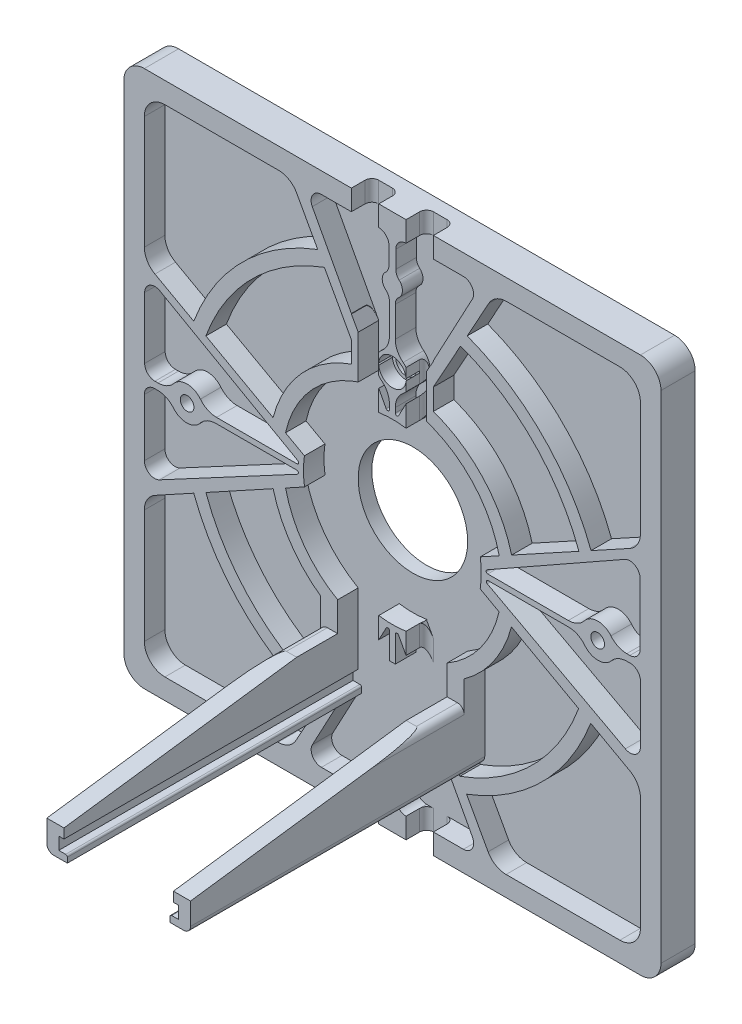
from build123d import *

# Parameters (mm, degrees)
EXTRUDE_2_DEPTH          = 5
SKETCH_6_R               = 13
CUT_EXTRUDE_2_DEPTH      = 3
CUT_EXTRUDE_4_DEPTH      = 3
SKETCH_12_R              = 18
SKETCH_12_R_2            = 16
EXTRUDE_7_DEPTH          = 3
SKETCH_18_R              = 31
SKETCH_18_R_2            = 29
EXTRUDE_10_DEPTH         = 3
CUT_EXTRUDE_7_DEPTH      = 3
CUT_EXTRUDE_7_DEPTH_BACK = 2
SKETCH_19_R              = 1
CHAMFER_6_SIZE           = 2
CUT_EXTRUDE_8_DEPTH      = 3
CUT_EXTRUDE_12_DEPTH     = 78.5
EXTRUDE_12_DEPTH         = 3
EXTRUDE_15_DEPTH         = 43
CUT_EXTRUDE_13_DEPTH     = 22
SKETCH_38_R              = 2
CUT_EXTRUDE_14_DEPTH     = 2
SKETCH_39_R              = 1.5
CUT_EXTRUDE_15_DEPTH     = 3
CUT_EXTRUDE_START        = -3
CUT_EXTRUDE_17_DEPTH     = 3
EXTRUDE_14_DEPTH         = 3
SKETCH_48_R              = 8
CUT_EXTRUDE_23_DEPTH     = 3


with BuildPart() as part:
    # Эскиз1 → Бобышка-Вытянуть2 (new body)
    with BuildSketch(Plane.XY):
        with BuildLine():
            Line((-36.25, -39.25), (36.25, -39.25))
            ThreePointArc((36.25, -39.25), (38.371320344, -38.371320344), (39.25, -36.25))
            Line((39.25, -36.25), (39.25, 36.25))
            ThreePointArc((39.25, 36.25), (38.371320344, 38.371320344), (36.25, 39.25))
            Line((36.25, 39.25), (-36.25, 39.25))
            ThreePointArc((-36.25, 39.25), (-38.371320344, 38.371320344), (-39.25, 36.25))
            Line((-39.25, 36.25), (-39.25, -36.25))
            ThreePointArc((-39.25, -36.25), (-38.371320344, -38.371320344), (-36.25, -39.25))
        make_face()
    extrude(amount=EXTRUDE_2_DEPTH)

    # Эскиз6 → Вырез-Вытянуть2 (cut)
    with BuildSketch(Plane.XY.offset(5)):
        Circle(SKETCH_6_R)
    extrude(amount=-CUT_EXTRUDE_2_DEPTH, mode=Mode.SUBTRACT)

    # Эскиз10 → Вырез-Вытянуть4 (cut)
    with BuildSketch(Plane.XY.offset(5)):
        with BuildLine():
            Line((-36.25, -33.25), (-36.25, -16.619482512))
            ThreePointArc((-36.25, -16.619482512), (-35.831646193, -15.091378152), (-34.69326471, -13.989465977))
            Line((-34.69326471, -13.989465977), (-12.845232579, -2))
            Line((-12.845232579, -2), (-2, -12.845232579))
            Line((-2, -12.845232579), (-14.087577933, -34.701877693))
            ThreePointArc((-14.087577933, -34.701877693), (-15.18897836, -35.834147159), (-16.712849569, -36.25))
            Line((-16.712849569, -36.25), (-33.25, -36.25))
            ThreePointArc((-33.25, -36.25), (-35.371320344, -35.371320344), (-36.25, -33.25))
        make_face()
        with BuildLine():
            Line((36.248456545, 33.245281978), (36.248456545, 16.61476449))
            ThreePointArc((36.248456545, 16.61476449), (35.830102738, 15.08666013), (34.691721255, 13.984747955))
            Line((34.691721255, 13.984747955), (12.843689124, 1.995281978))
            Line((12.843689124, 1.995281978), (1.998456545, 12.840514557))
            Line((1.998456545, 12.840514557), (14.086034478, 34.697159671))
            ThreePointArc((14.086034478, 34.697159671), (15.187434905, 35.829429137), (16.711306114, 36.245281978))
            Line((16.711306114, 36.245281978), (33.248456545, 36.245281978))
            ThreePointArc((33.248456545, 36.245281978), (35.369776888, 35.366602321), (36.248456545, 33.245281978))
        make_face()
        with BuildLine():
            Line((33.245281978, -36.317324444), (16.61476449, -36.317324444))
            ThreePointArc((16.61476449, -36.317324444), (15.08666013, -35.898970637), (13.984747955, -34.760589154))
            Line((13.984747955, -34.760589154), (1.995281978, -12.912557022))
            Line((1.995281978, -12.912557022), (12.840514557, -2.067324444))
            Line((12.840514557, -2.067324444), (34.697159671, -14.154902376))
            ThreePointArc((34.697159671, -14.154902376), (35.829429137, -15.256302804), (36.245281978, -16.780174013))
            Line((36.245281978, -16.780174013), (36.245281978, -33.317324444))
            ThreePointArc((36.245281978, -33.317324444), (35.366602321, -35.438644787), (33.245281978, -36.317324444))
        make_face()
        with BuildLine():
            Line((-33.25, 36.181132101), (-16.619482512, 36.181132101))
            ThreePointArc((-16.619482512, 36.181132101), (-15.091378152, 35.762778294), (-13.989465977, 34.624396812))
            Line((-13.989465977, 34.624396812), (-2, 12.77636468))
            Line((-2, 12.77636468), (-12.845232579, 1.931132101))
            Line((-12.845232579, 1.931132101), (-34.701877693, 14.018710034))
            ThreePointArc((-34.701877693, 14.018710034), (-35.834147159, 15.120110462), (-36.25, 16.64398167))
            Line((-36.25, 16.64398167), (-36.25, 33.181132101))
            ThreePointArc((-36.25, 33.181132101), (-35.371320344, 35.302452445), (-33.25, 36.181132101))
        make_face()
    extrude(amount=-CUT_EXTRUDE_4_DEPTH, mode=Mode.SUBTRACT)

    # Эскиз12 → Бобышка-Вытянуть7 (add)
    with BuildSketch(Plane.XY.offset(2)):
        Circle(SKETCH_12_R)
        Circle(SKETCH_12_R_2, mode=Mode.SUBTRACT)
    extrude(amount=EXTRUDE_7_DEPTH)

    # Эскиз18 → Бобышка-Вытянуть10 (add)
    with BuildSketch(Plane.XY.offset(2)):
        Circle(SKETCH_18_R)
        Circle(SKETCH_18_R_2, mode=Mode.SUBTRACT)
    extrude(amount=EXTRUDE_10_DEPTH)

    # Эскиз19 → Вырез-Вытянуть7 (cut, two sides: drawn at the far end of the back side and taken through both)
    with BuildSketch(Plane.XY.offset(2).offset(-CUT_EXTRUDE_7_DEPTH_BACK)):
        with Locations((-30, 0)):
            Circle(SKETCH_19_R)
        with Locations((30, 0)):
            Circle(SKETCH_19_R)
    extrude(amount=CUT_EXTRUDE_7_DEPTH + CUT_EXTRUDE_7_DEPTH_BACK, mode=Mode.SUBTRACT)

    # Фаска6
    chamfer_6_edges = [part.edges().sort_by_distance(p)[0] for p in [
        (-31, 0, 0),
        (29, 0, 0),
    ]]
    chamfer(chamfer_6_edges, length=CHAMFER_6_SIZE - 0.0001)  # a hair under: the kernel refuses the full size

    # Эскиз21 → Вырез-Вытянуть8 (cut)
    with BuildSketch(Plane.XY.offset(5)):
        with BuildLine():
            Line((-34.704620743, 0.454307302), (-34.254311921, 0.454307302))
            ThreePointArc((-34.254311921, 0.454307302), (-32.975007388, 0.740752454), (-31.940003243, 1.545387361))
            ThreePointArc((-31.940003243, 1.545387361), (-29.988572961, 2.454516411), (-28.054079136, 1.509884517))
            ThreePointArc((-28.054079136, 1.509884517), (-27.009013247, 0.674298621), (-25.704595988, 0.376201124))
            Line((-25.704595988, 0.376201124), (-13.943899103, 0.378878245))
            ThreePointArc((-13.943899103, 0.378878245), (-13.702182333, 0.565274083), (-13.820883988, 0.84648632))
            Line((-13.820883988, 0.84648632), (-33.966188607, 12.240012563))
            ThreePointArc((-33.966188607, 12.240012563), (-35.460382543, 12.23005852), (-36.204620743, 10.934364073))
            Line((-36.204620743, 10.934364073), (-36.204620743, 1.954307302))
            ThreePointArc((-36.204620743, 1.954307302), (-35.765280915, 0.89364713), (-34.704620743, 0.454307302))
        make_face()
        with BuildLine():
            Line((-25.761044938, -0.43461173), (-13.989761952, -0.43461173))
            ThreePointArc((-13.989761952, -0.43461173), (-13.747273757, -0.623788417), (-13.871770468, -0.905015927))
            Line((-13.871770468, -0.905015927), (-34.04205417, -11.703003176))
            ThreePointArc((-34.04205417, -11.703003176), (-35.520741889, -11.667419743), (-36.250003072, -10.380577998))
            Line((-36.250003072, -10.380577998), (-36.250003072, -2.005063818))
            ThreePointArc((-36.250003072, -2.005063818), (-35.810660174, -0.944400576), (-34.749994387, -0.505063818))
            Line((-34.749994387, -0.505063818), (-34.295230554, -0.505066451))
            ThreePointArc((-34.295230554, -0.505066451), (-33.017657052, -0.79070436), (-31.983362839, -1.593212023))
            ThreePointArc((-31.983362839, -1.593212023), (-30.03615371, -2.499914811), (-28.104179663, -1.56118715))
            ThreePointArc((-28.104179663, -1.56118715), (-27.060992294, -0.730885252), (-25.761044938, -0.43461173))
        make_face()
        with BuildLine():
            Line((-0.495022641, -34.75006596), (-0.495022641, -32.204632927))
            ThreePointArc((-0.495022641, -32.204632927), (-0.623947966, -31.596229906), (-0.988561622, -31.092411628))
            ThreePointArc((-0.988561622, -31.092411628), (-1.473098084, -29.976854334), (-0.953653161, -28.877117715))
            ThreePointArc((-0.953653161, -28.877117715), (-0.563252055, -28.363667136), (-0.424570548, -27.733737013))
            Line((-0.424570548, -27.733737013), (-0.424570548, -13.98982484))
            ThreePointArc((-0.424570548, -13.98982484), (-0.613747234, -13.747336645), (-0.894974744, -13.871833356))
            Line((-0.894974744, -13.871833356), (-11.692961993, -34.042117058))
            ThreePointArc((-11.692961993, -34.042117058), (-11.65737856, -35.520804777), (-10.370536815, -36.25006596))
            Line((-10.370536815, -36.25006596), (-1.995022641, -36.25006596))
            ThreePointArc((-1.995022641, -36.25006596), (-0.934362469, -35.810726132), (-0.495022641, -34.75006596))
        make_face()
        with BuildLine():
            Line((0.43452545, -27.733740085), (0.43452545, -13.989827912))
            ThreePointArc((0.43452545, -13.989827912), (0.623702136, -13.747339717), (0.904929646, -13.871836428))
            Line((0.904929646, -13.871836428), (11.702916895, -34.04212013))
            ThreePointArc((11.702916895, -34.04212013), (11.667333462, -35.520807849), (10.380491717, -36.250069033))
            Line((10.380491717, -36.250069033), (2.004977543, -36.250069033))
            ThreePointArc((2.004977543, -36.250069033), (0.944317371, -35.810729204), (0.504977543, -34.750069033))
            Line((0.504977543, -34.750069033), (0.504977543, -32.204635999))
            ThreePointArc((0.504977543, -32.204635999), (0.633902868, -31.596232978), (0.998516524, -31.0924147))
            ThreePointArc((0.998516524, -31.0924147), (1.483052986, -29.976857406), (0.963608063, -28.877120787))
            ThreePointArc((0.963608063, -28.877120787), (0.573206957, -28.363670209), (0.43452545, -27.733740085))
        make_face()
        with BuildLine():
            Line((0.492820643, 34.75379854), (0.492820643, 32.208365506))
            ThreePointArc((0.492820643, 32.208365506), (0.621745968, 31.599962486), (0.986359624, 31.096144208))
            ThreePointArc((0.986359624, 31.096144208), (1.470896087, 29.980586914), (0.951451164, 28.880850294))
            ThreePointArc((0.951451164, 28.880850294), (0.561050057, 28.367399716), (0.42236855, 27.737469593))
            Line((0.42236855, 27.737469593), (0.42236855, 23.323589505))
            ThreePointArc((0.42236855, 23.323589505), (0.72472932, 22.011056615), (1.570863607, 20.963096029))
            ThreePointArc((1.570863607, 20.963096029), (2.52600545, 19), (1.570863607, 17.036903971))
            ThreePointArc((1.570863607, 17.036903971), (0.72472932, 15.988943385), (0.42236855, 14.676410495))
            Line((0.42236855, 14.676410495), (0.42236855, 13.993557419))
            ThreePointArc((0.42236855, 13.993557419), (0.611545237, 13.751069225), (0.892772746, 13.875565935))
            Line((0.892772746, 13.875565935), (11.690759995, 34.045849637))
            ThreePointArc((11.690759995, 34.045849637), (11.655176563, 35.524537356), (10.368334817, 36.25379854))
            Line((10.368334817, 36.25379854), (1.992820643, 36.25379854))
            ThreePointArc((1.992820643, 36.25379854), (0.932160471, 35.814458712), (0.492820643, 34.75379854))
        make_face()
        with BuildLine():
            Line((-2.00717954, 36.253801612), (-10.382693714, 36.253801612))
            ThreePointArc((-10.382693714, 36.253801612), (-11.669535459, 35.524540429), (-11.705118892, 34.04585271))
            Line((-11.705118892, 34.04585271), (-0.907131643, 13.875569008))
            ThreePointArc((-0.907131643, 13.875569008), (-0.625904134, 13.751072297), (-0.436727447, 13.993560492))
            Line((-0.436727447, 13.993560492), (-0.436727447, 14.729814514))
            ThreePointArc((-0.436727447, 14.729814514), (-0.727107542, 16.017432459), (-1.542034095, 17.055784657))
            ThreePointArc((-1.542034095, 17.055784657), (-2.465929938, 19), (-1.542034095, 20.944215343))
            ThreePointArc((-1.542034095, 20.944215343), (-0.727107542, 21.982567541), (-0.436727447, 23.270185486))
            Line((-0.436727447, 23.270185486), (-0.436727447, 27.737472665))
            ThreePointArc((-0.436727447, 27.737472665), (-0.575408954, 28.367402788), (-0.965810061, 28.880853367))
            ThreePointArc((-0.965810061, 28.880853367), (-1.485254984, 29.980589986), (-1.000718521, 31.09614728))
            ThreePointArc((-1.000718521, 31.09614728), (-0.636104865, 31.599965558), (-0.50717954, 32.208368579))
            Line((-0.50717954, 32.208368579), (-0.50717954, 34.753801612))
            ThreePointArc((-0.50717954, 34.753801612), (-0.946519368, 35.814461784), (-2.00717954, 36.253801612))
        make_face()
        with BuildLine():
            Line((34.749994387, -0.505063818), (34.295230554, -0.505066451))
            ThreePointArc((34.295230554, -0.505066451), (33.017657052, -0.79070436), (31.983362839, -1.593212023))
            ThreePointArc((31.983362839, -1.593212023), (30.03615371, -2.499914811), (28.104179663, -1.56118715))
            ThreePointArc((28.104179663, -1.56118715), (27.060992294, -0.730885252), (25.761044938, -0.43461173))
            Line((25.761044938, -0.43461173), (13.989761952, -0.43461173))
            ThreePointArc((13.989761952, -0.43461173), (13.747273757, -0.623788417), (13.871770468, -0.905015927))
            Line((13.871770468, -0.905015927), (34.04205417, -11.703003176))
            ThreePointArc((34.04205417, -11.703003176), (35.520741889, -11.667419743), (36.250003072, -10.380577998))
            Line((36.250003072, -10.380577998), (36.250003072, -2.005063818))
            ThreePointArc((36.250003072, -2.005063818), (35.810660174, -0.944400576), (34.749994387, -0.505063818))
        make_face()
        with BuildLine():
            Line((34.704620743, 0.454307302), (34.254311921, 0.454307302))
            ThreePointArc((34.254311921, 0.454307302), (32.975007388, 0.740752454), (31.940003243, 1.545387361))
            ThreePointArc((31.940003243, 1.545387361), (29.988572961, 2.454516411), (28.054079136, 1.509884517))
            ThreePointArc((28.054079136, 1.509884517), (27.009013247, 0.674298621), (25.704595988, 0.376201124))
            Line((25.704595988, 0.376201124), (13.943899103, 0.378878245))
            ThreePointArc((13.943899103, 0.378878245), (13.702182333, 0.565274083), (13.820883988, 0.84648632))
            Line((13.820883988, 0.84648632), (33.966188607, 12.240012563))
            ThreePointArc((33.966188607, 12.240012563), (35.460382543, 12.23005852), (36.204620743, 10.934364073))
            Line((36.204620743, 10.934364073), (36.204620743, 1.954307302))
            ThreePointArc((36.204620743, 1.954307302), (35.765280915, 0.89364713), (34.704620743, 0.454307302))
        make_face()
    extrude(amount=-CUT_EXTRUDE_8_DEPTH, mode=Mode.SUBTRACT)

    # Эскиз27 → Вырез-Вытянуть12 (cut)
    with BuildSketch(Plane(origin=(0, -39.25, 0), x_dir=(-1, 0, 0), z_dir=(0, -1, 0))):
        with BuildLine():
            Line((1.995022641, -5), (5.993158737, -5))
            Line((5.993158737, -5), (5.993158737, -3))
            ThreePointArc((5.993158737, -3), (5.700265518, -2.292893219), (4.993158737, -2))
            Line((4.993158737, -2), (2.995022641, -2))
            ThreePointArc((2.995022641, -2), (2.28791586, -2.292893219), (1.995022641, -3))
            Line((1.995022641, -3), (1.995022641, -5))
        make_face()
        with BuildLine():
            Line((-1.995022641, -3), (-1.995022641, -5))
            Line((-1.995022641, -5), (-5.993158737, -5))
            Line((-5.993158737, -5), (-5.993158737, -3))
            ThreePointArc((-5.993158737, -3), (-5.700265518, -2.292893219), (-4.993158737, -2))
            Line((-4.993158737, -2), (-2.995022641, -2))
            ThreePointArc((-2.995022641, -2), (-2.28791586, -2.292893219), (-1.995022641, -3))
        make_face()
    extrude(amount=-CUT_EXTRUDE_12_DEPTH, mode=Mode.SUBTRACT)

    # Эскиз28 → Бобышка-Вытянуть12 (add)
    with BuildSketch(Plane.XY.offset(2)):
        Polygon((-5.993158737, -14.835162566), (-5.993158737, -23.395072746), (-4.993158737, -21.527105759), (-4.993158737, -15.200933058), align=None)
        Polygon((5.993158737, -14.835162566), (5.993158737, -23.37648039), (4.993158737, -21.508513403), (4.993158737, -15.200933058), align=None)
        Polygon((-4.993158737, 15.200933058), (-4.993158737, 21.508132724), (-5.993158737, 23.312460433), (-5.993158737, 14.835162566), align=None)
        Polygon((5.993158737, 14.835162566), (5.993158737, 23.312460433), (4.993158737, 21.534951597), (4.993158737, 15.200933058), align=None)
    extrude(amount=EXTRUDE_12_DEPTH)

    # Эскиз22 → Бобышка-Вытянуть15 (add)
    with BuildSketch(Plane(origin=(0, 48.415106794, 2), x_dir=(1, 0, 0), z_dir=(0, 0, 1))):
        with BuildLine():
            Line((-8.75, -74.361359055), (-7.75, -74.361359055))
            ThreePointArc((-7.75, -74.361359055), (-7.573223305, -74.43458236), (-7.5, -74.611359055))
            Line((-7.5, -74.611359055), (-7.5, -75.361359055))
            Line((-7.5, -75.361359055), (-9.5, -75.361359055))
            ThreePointArc((-9.5, -75.361359055), (-10.207106781, -75.068465837), (-10.5, -74.361359055))
            Line((-10.5, -74.361359055), (-10.5, -72.061359055))
            Line((-10.5, -72.061359055), (-10.5, -71.561359055))
            Line((-10.5, -71.561359055), (-10.5, -67.557480056))
            ThreePointArc((-10.5, -67.557480056), (-10.207106781, -66.850373275), (-9.5, -66.557480056))
            Line((-9.5, -66.557480056), (-8, -66.557480056))
            Line((-8, -66.557480056), (-8, -72.561359055))
            Line((-8, -72.561359055), (-8.75, -72.561359055))
            Line((-8.75, -72.561359055), (-8.75, -74.361359055))
        make_face()
        with BuildLine():
            Line((9.5, -66.557480056), (8, -66.557480056))
            Line((8, -66.557480056), (8, -72.561359055))
            Line((8, -72.561359055), (8.75, -72.561359055))
            Line((8.75, -72.561359055), (8.75, -74.361359055))
            Line((8.75, -74.361359055), (7.75, -74.361359055))
            ThreePointArc((7.75, -74.361359055), (7.573223305, -74.43458236), (7.5, -74.611359055))
            Line((7.5, -74.611359055), (7.5, -75.361359055))
            Line((7.5, -75.361359055), (9.5, -75.361359055))
            ThreePointArc((9.5, -75.361359055), (10.207106781, -75.068465837), (10.5, -74.361359055))
            Line((10.5, -74.361359055), (10.5, -72.061359055))
            Line((10.5, -72.061359055), (10.5, -71.561359055))
            Line((10.5, -71.561359055), (10.5, -67.557480056))
            ThreePointArc((10.5, -67.557480056), (10.207106781, -66.850373275), (9.5, -66.557480056))
        make_face()
    extrude(amount=EXTRUDE_15_DEPTH)

    # Эскиз36 → Вырез-Вытянуть13 (cut)
    with BuildSketch(Plane.ZY.offset(10.5)):
        Polygon((48, -17.360626583), (5.199581412, -17.360626583), (48, -23.143489845), align=None)
    extrude(amount=-CUT_EXTRUDE_13_DEPTH, mode=Mode.SUBTRACT)

    # Эскиз38 → Вырез-Вытянуть14 (cut)
    with BuildSketch(Plane.XY.offset(5)):
        with Locations((0, 18.976716711)):
            Circle(SKETCH_38_R)
    extrude(amount=-CUT_EXTRUDE_14_DEPTH, mode=Mode.SUBTRACT)

    # Эскиз39 → Вырез-Вытянуть15 (cut)
    with BuildSketch(Plane.XY.offset(3)):
        with Locations((0, 18.976716711)):
            Circle(SKETCH_39_R)
    extrude(amount=-CUT_EXTRUDE_15_DEPTH, mode=Mode.SUBTRACT)

    # Эскиз43 → Вырез-Вытянуть17 (cut)
    with BuildSketch(Plane.XY.offset(5).offset(CUT_EXTRUDE_START)):
        with BuildLine():
            Line((-7.5, -26.196252262), (-7.5, -26.946252262))
            Line((-7.5, -26.946252262), (7.5, -26.946252262))
            Line((7.5, -26.946252262), (7.5, -26.196252262))
            ThreePointArc((7.5, -26.196252262), (7.573223305, -26.019475567), (7.75, -25.946252262))
            Line((7.75, -25.946252262), (8.75, -25.946252262))
            Line((8.75, -25.946252262), (8.75, -24.146252262))
            Line((8.75, -24.146252262), (8, -24.146252262))
            Line((8, -24.146252262), (8, -13.004110539))
            Line((8, -13.004110539), (4.221795278, -15.022761917))
            Line((4.221795278, -15.022761917), (2.995022641, -17.776061141))
            Line((2.995022641, -17.776061141), (-2.995022641, -17.794653497))
            Line((-2.995022641, -17.794653497), (-4.634807155, -13.895300362))
            Line((-4.634807155, -13.895300362), (-8, -12.998727574))
            Line((-8, -12.998727574), (-8, -24.146252262))
            Line((-8, -24.146252262), (-8.75, -24.146252262))
            Line((-8.75, -24.146252262), (-8.75, -25.946252262))
            Line((-8.75, -25.946252262), (-7.75, -25.946252262))
            ThreePointArc((-7.75, -25.946252262), (-7.573223305, -26.019475567), (-7.5, -26.196252262))
        make_face()
    extrude(amount=CUT_EXTRUDE_17_DEPTH, mode=Mode.SUBTRACT)

    # Эскиз45 → Бобышка-Вытянуть14 (add)
    with BuildSketch(Plane.XY.offset(2)):
        Polygon((-10.5, -19.142373262), (-8, -19.142373262), (-8, -16.124515497), (-10.5, -13.72569562), align=None)
        Polygon((10.5, -19.142373262), (8, -19.142373262), (8, -16.124515497), (10.5, -13.72569562), align=None)
    extrude(amount=EXTRUDE_14_DEPTH)

    # Эскиз48 → Вырез-Вытянуть23 (cut)
    with BuildSketch(Plane.XY.offset(2)):
        Circle(SKETCH_48_R)
    extrude(amount=-CUT_EXTRUDE_23_DEPTH, mode=Mode.SUBTRACT)


solid = part.part
